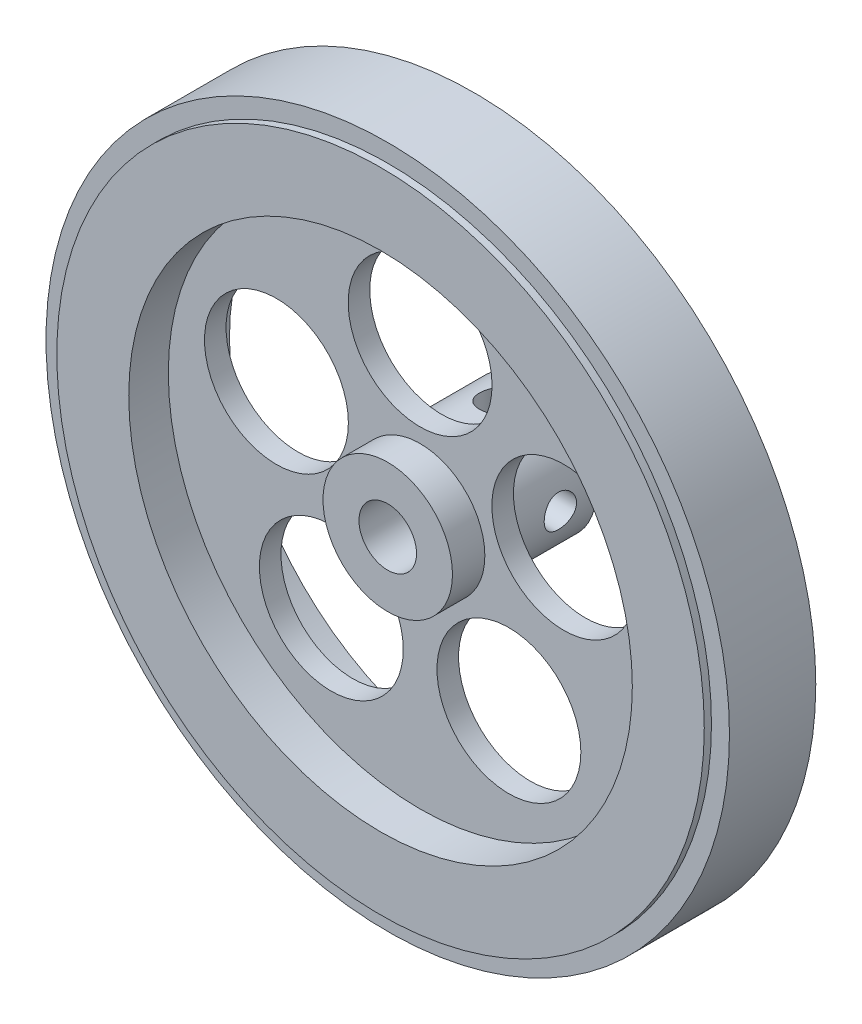
from build123d import *

# Parameters (mm, degrees)
SKETCH_1_R               = 9
SKETCH_1_R_2             = 4
EXTRUDE_1_DEPTH          = 20
EXTRUDE_2_DEPTH          = 1.5
EXTRUDE_2_DEPTH_BACK     = 1.5
SKETCH_2_R               = 45
CUT_EXTRUDE_2_DEPTH      = 67.708320321
CUT_EXTRUDE_2_DEPTH_BACK = 67.708320321
SKETCH_1_2_R             = 4
CUT_EXTRUDE_3_DEPTH      = 66.5
CUT_EXTRUDE_3_DEPTH_BACK = 66.5
SKETCH_3_R               = 10
EXTRUDE_3_DEPTH          = 7
EXTRUDE_3_DEPTH_BACK     = 7
SKETCH_5_R               = 45
SKETCH_5_R_2             = 35
EXTRUDE_4_DEPTH          = 6
EXTRUDE_4_DEPTH_BACK     = 6
SKETCH_6_R               = 47.5
SKETCH_6_R_2             = 45


with BuildPart() as part:
    # 스케치1 → 보스-돌출1 (new body)
    with BuildSketch(Plane.XY):
        Circle(SKETCH_1_R)
        Circle(SKETCH_1_R_2, mode=Mode.SUBTRACT)
    extrude(amount=EXTRUDE_1_DEPTH)

    # 스케치2 → 보스-돌출2 (add, two sides: drawn at the far end of the back side and taken through both)
    with BuildSketch(Plane.XY.offset(14).offset(-EXTRUDE_2_DEPTH_BACK)):
        Circle(SKETCH_2_R)
    extrude(amount=EXTRUDE_2_DEPTH + EXTRUDE_2_DEPTH_BACK)

    # 스케치1<2> → 컷-돌출2 (cut, two sides: drawn at the far end of the back side and taken through both)
    with BuildSketch(Plane.XY.offset(-CUT_EXTRUDE_2_DEPTH_BACK)):
        Circle(SKETCH_1_2_R)
    extrude(amount=CUT_EXTRUDE_2_DEPTH + CUT_EXTRUDE_2_DEPTH_BACK, mode=Mode.SUBTRACT)

    # 스케치3 → 컷-돌출3 (cut, two sides: drawn at the far end of the back side and taken through both)
    with BuildSketch(Plane.XY.offset(15.5).offset(-CUT_EXTRUDE_3_DEPTH_BACK)):
        with Locations((0, 21)):
            Circle(SKETCH_3_R)
        with Locations((19.972186842, 6.489356882)):
            Circle(SKETCH_3_R)
        with Locations((12.343490298, -16.989356882)):
            Circle(SKETCH_3_R)
        with Locations((-12.343490298, -16.989356882)):
            Circle(SKETCH_3_R)
        with Locations((-19.972186842, 6.489356882)):
            Circle(SKETCH_3_R)
    extrude(amount=CUT_EXTRUDE_3_DEPTH + CUT_EXTRUDE_3_DEPTH_BACK, mode=Mode.SUBTRACT)

    # 스케치5 → 보스-돌출3 (add, two sides: drawn at the far end of the back side and taken through both)
    with BuildSketch(Plane.XY.offset(14).offset(-EXTRUDE_3_DEPTH_BACK)):
        Circle(SKETCH_5_R)
        Circle(SKETCH_5_R_2, mode=Mode.SUBTRACT)
    extrude(amount=EXTRUDE_3_DEPTH + EXTRUDE_3_DEPTH_BACK)

    # 스케치6 → 보스-돌출4 (add, two sides: drawn at the far end of the back side and taken through both)
    with BuildSketch(Plane.XY.offset(14).offset(-EXTRUDE_4_DEPTH_BACK)):
        Circle(SKETCH_6_R)
        Circle(SKETCH_6_R_2, mode=Mode.SUBTRACT)
    extrude(amount=EXTRUDE_4_DEPTH + EXTRUDE_4_DEPTH_BACK)

    # 스케치9 → M4 여유 구멍1 (revolve, cut)
    with BuildSketch(Plane(origin=(0, 0, 5), x_dir=(0, 0, -1), z_dir=(1, 0, 0))):
        Polygon((0, 0), (0, 31.351936393), (2.25, 30), (2.25, 0), align=None)
    revolve(axis=Axis((0, -6.35, 5), (0, 1, 0)), mode=Mode.SUBTRACT)

    # 스케치12 → M4 여유 구멍2 (revolve, cut)
    with BuildSketch(Plane(origin=(0, 0, 5), x_dir=(0, 0, 1), z_dir=(0, 1, 0))):
        Polygon((0, 0), (0, 31.351936393), (2.25, 30), (2.25, 0), align=None)
    revolve(axis=Axis((-6.35, 0, 5), (1, 0, 0)), mode=Mode.SUBTRACT)


solid = part.part
